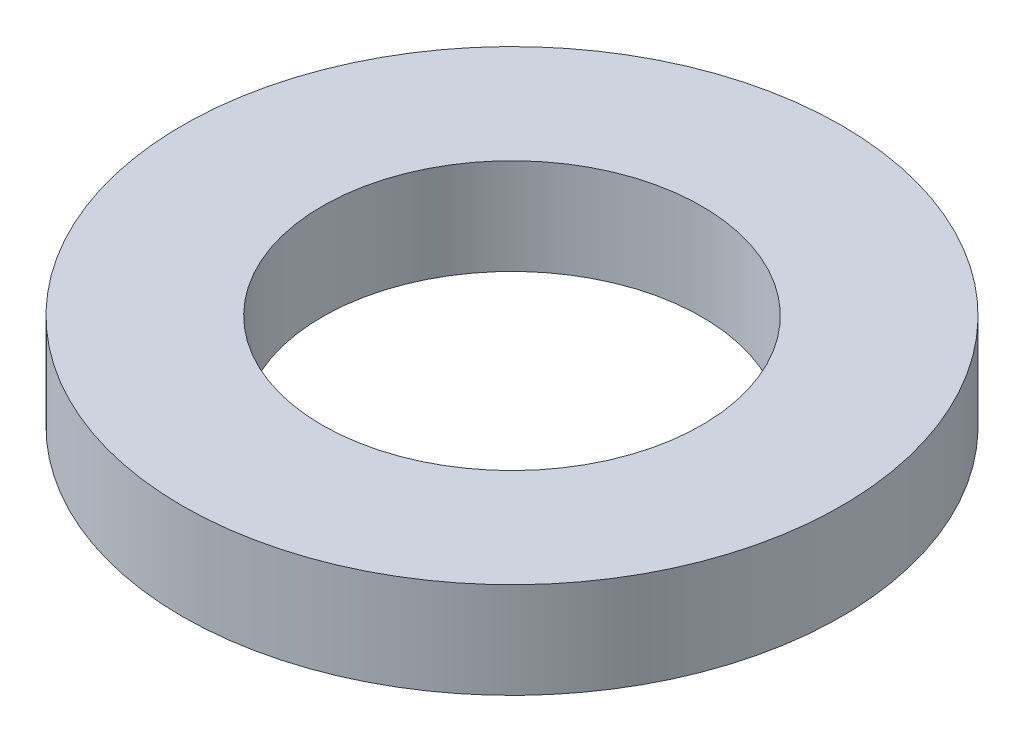
from build123d import *

# Parameters (mm, degrees)
SKETCH1_R           = 82.5
BOSS_EXTRUDE1_DEPTH = 24
SKETCH2_R           = 47.5
CUT_EXTRUDE1_DEPTH  = 120.115490177


with BuildPart() as part:
    # Sketch1 → Boss-Extrude1 (new body)
    with BuildSketch(Plane(origin=(0, 0, 0), x_dir=(1, 0, 0), z_dir=(0, 1, 0))):
        Circle(SKETCH1_R)
    extrude(amount=BOSS_EXTRUDE1_DEPTH)

    # Sketch2 → Cut-Extrude1 (cut, through all)
    with BuildSketch(Plane(origin=(0, 0, 0), x_dir=(1, 0, 0), z_dir=(0, 1, 0))):
        Circle(SKETCH2_R)
    extrude(amount=CUT_EXTRUDE1_DEPTH, mode=Mode.SUBTRACT)


solid = part.part
